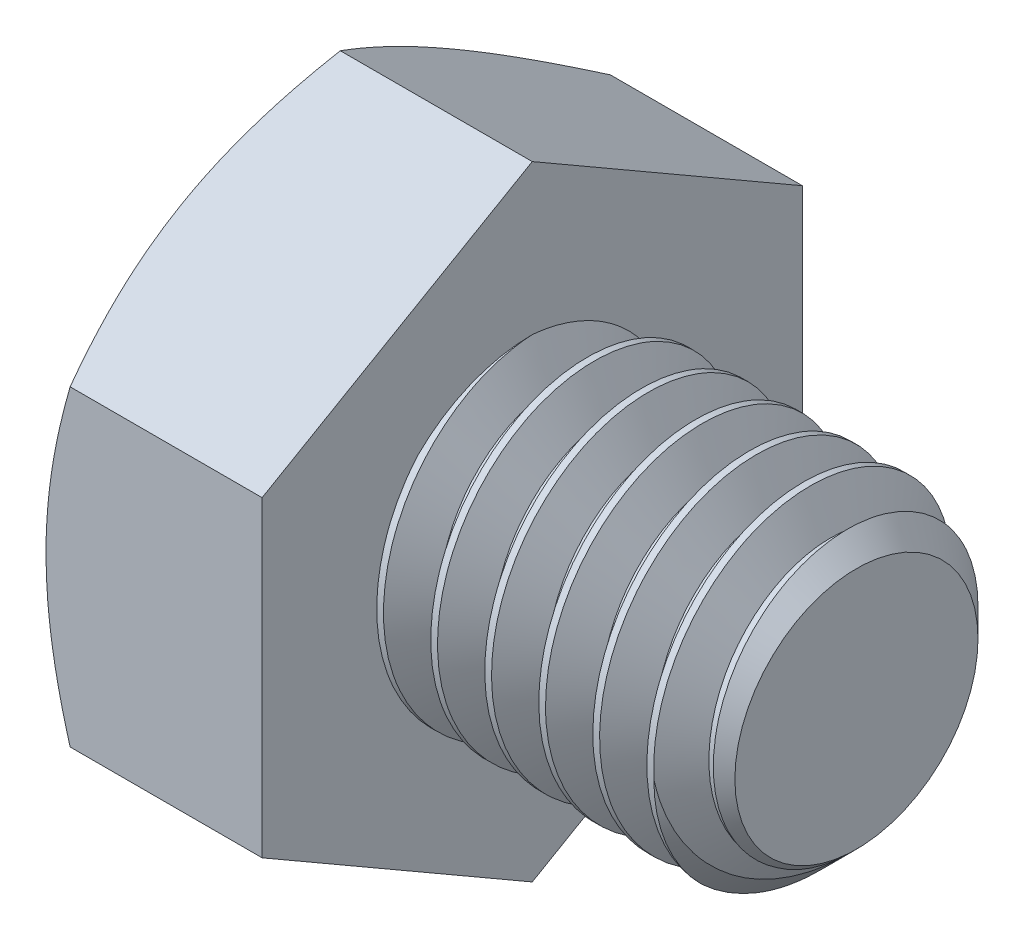
from build123d import *

# Parameters (mm, degrees)
SKETCH2_R           = 3
BOSS_EXTRUDE1_DEPTH = 6
CHAMFER1_SIZE       = 0.75
CUT_SWEEP1_PITCH    = 1
BOSS_EXTRUDE2_DEPTH = 4
SKETCH6_OUTSIDE_W   = 62.704
SKETCH6_OUTSIDE_H   = 64.252
SKETCH6_OUTSIDE_R   = 5
CUT_EXTRUDE1_DEPTH  = 13.583057557
CUT_EXTRUDE1_DRAFT  = -60


with BuildPart() as part:
    # Sketch2 → Boss-Extrude1 (new body)
    with BuildSketch(Plane(origin=(5, 0, 0), x_dir=(0, 0, -1), z_dir=(1, 0, 0))):
        Circle(SKETCH2_R)
    extrude(amount=-BOSS_EXTRUDE1_DEPTH)

    # Chamfer1
    chamfer1_edges = [part.edges().sort_by_distance(p)[0] for p in [
        (5, 0, 3),
    ]]
    chamfer(chamfer1_edges, length=CHAMFER1_SIZE)

    # Cut-Sweep1: the profile of Sketch5 profile screwed along a right-hand helix of 7 turns, 8 arcs to a turn; built about Z, then put on its axis
    cut_sweep1_z = Axis((0, 0, 0), (0, 0, 1))
    cut_sweep1_corners = [(3.0003, 0, 0.000173205), (2.350480947, 0, -0.375), (2.350480947, 0, -0.5), (3.0003, 0, -0.875173205)]
    with BuildLine(mode=Mode.PRIVATE) as cut_sweep1_profile:
        Line(cut_sweep1_corners[0], cut_sweep1_corners[1])
        Line(cut_sweep1_corners[1], cut_sweep1_corners[2])
        Line(cut_sweep1_corners[2], cut_sweep1_corners[3])
        Line(cut_sweep1_corners[3], cut_sweep1_corners[0])
    cut_sweep1_cap = Face(cut_sweep1_profile.wire())
    cut_sweep1_turn_angles = [0, 22.5, 45, 67.5, 90, 112.5, 135, 157.5, 180, 202.5, 225, 247.5, 270, 292.5, 315, 337.5, 360]
    cut_sweep1_turn_weights = [1, 0.9238795325112867, 1, 0.9238795325112867, 1, 0.9238795325112867, 1, 0.9238795325112867, 1, 0.9238795325112867, 1, 0.9238795325112867, 1, 0.9238795325112867, 1, 0.9238795325112867, 1]
    cut_sweep1_turn_rails = [Edge.make_bspline([Vector(p[0], p[1], 0).rotate(cut_sweep1_z, cut_sweep1_turn_angles[k]) / cut_sweep1_turn_weights[k] + Vector(0, 0, p[2] + CUT_SWEEP1_PITCH * cut_sweep1_turn_angles[k] / 360) for k in range(17)], [0, 0, 0, 1, 1, 2, 2, 3, 3, 4, 4, 5, 5, 6, 6, 7, 7, 8, 8, 8], 2, cut_sweep1_turn_weights) for p in cut_sweep1_corners]
    cut_sweep1_turn_sides = [Face.make_surface_from_curves(cut_sweep1_turn_rails[p[0]], cut_sweep1_turn_rails[p[1]]) for p in [(0, 1), (1, 2), (2, 3), (3, 0)]]
    cut_sweep1 = Plane(origin=(5, 0, 0), x_dir=(0, 1, 0), z_dir=(-1, 0, 0)) * Solid(Shell([*[p.moved(Location((0, 0, CUT_SWEEP1_PITCH * i))) for i in range(7) for p in cut_sweep1_turn_sides], cut_sweep1_cap, cut_sweep1_cap.rotate(cut_sweep1_z, 2520).moved(Location((0, 0, CUT_SWEEP1_PITCH * 2520 / 360)))]))
    add(cut_sweep1, mode=Mode.SUBTRACT)

    # Sketch3 → Boss-Extrude2 (add)
    with BuildSketch(Plane.ZY.offset(1)):
        Polygon((-5, -2.886751346), (0, -5.773502692), (5, -2.886751346), (5, 2.886751346), (0, 5.773502692), (-5, 2.886751346), align=None)
    extrude(amount=BOSS_EXTRUDE2_DEPTH)


with BuildPart() as cut_extrude1_tool:
    # Sketch6 outside → Cut-Extrude1 (with draft: the straight prism first)
    with BuildSketch(Plane.ZY.offset(5)):
        Rectangle(SKETCH6_OUTSIDE_W, SKETCH6_OUTSIDE_H)
        Circle(SKETCH6_OUTSIDE_R, mode=Mode.SUBTRACT)
    extrude(amount=-CUT_EXTRUDE1_DEPTH)
    # Cut-Extrude1: the draft: its side faces are tilted about the plane it starts from
    cut_extrude1_sides = [cut_extrude1_tool.faces().sort_by_distance(p)[0] for p in [
        (1.791528779, -32.126, 0),
        (1.791528779, 0, 31.352),
        (1.791528779, 32.126, 0),
        (1.791528779, 0, -31.352),
        (1.791528779, 0, -5),
    ]]
    draft(cut_extrude1_sides, Plane.ZY.offset(5), CUT_EXTRUDE1_DRAFT)


with BuildPart() as part_1:
    add(part.part)

    # Cut-Extrude1: cut by cut_extrude1_tool
    add(cut_extrude1_tool.part, mode=Mode.SUBTRACT)


solid = part_1.part
